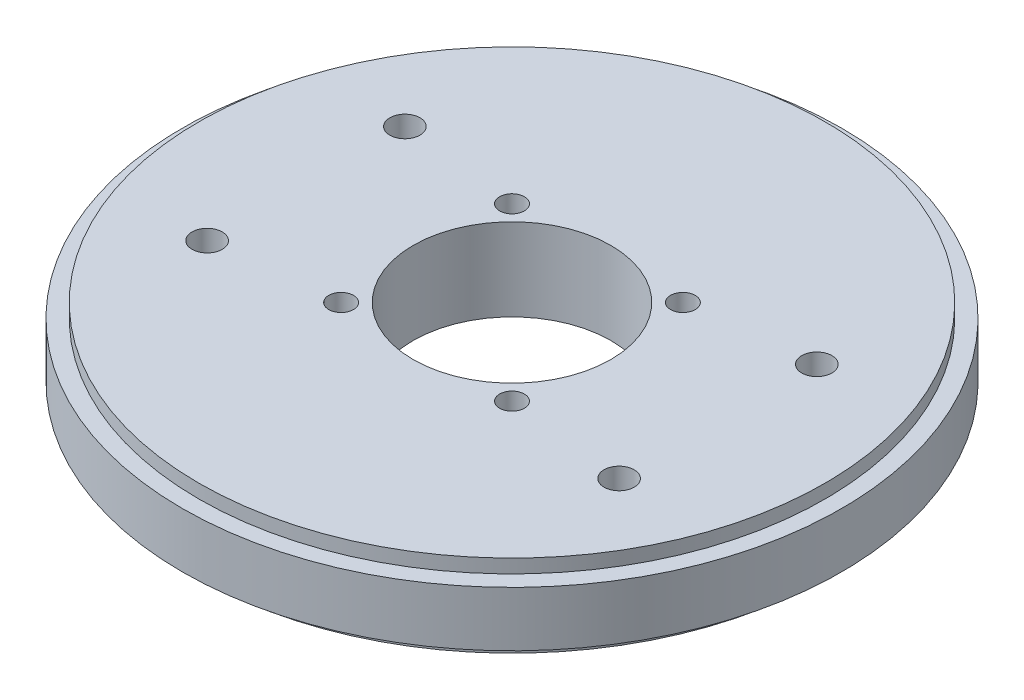
from build123d import *

# Parameters (mm, degrees)
SKETCH1_R                  = 57
EXTRUDE4_DEPTH             = 7.5
SKETCH_R                   = 60
SKETCH_R_2                 = 57
EXTRUDE5_DEPTH             = 5
EXTRUDE6_DEPTH             = 86.183625187
EXTRUDE6_DEPTH_BACK        = 86.183625187
SKETCH5_R                  = 18
F_4_5_4_5_DIAMETER_HOLE1_D = 4.5
CIRPATTERN1_COUNT          = 4
M5_CLEARANCE_HOLE1_D       = 5.5


with BuildPart() as part:
    # Sketch1 → Extrude4 (new, symmetric)
    with BuildSketch(Plane(origin=(0, 0, 0), x_dir=(1, 0, 0), z_dir=(0, 1, 0))):
        Circle(SKETCH1_R)
    extrude(amount=EXTRUDE4_DEPTH, both=True)

    # Sketch → Extrude5 (add, symmetric)
    with BuildSketch(Plane(origin=(0, 0, 0), x_dir=(1, 0, 0), z_dir=(0, 1, 0))):
        Circle(SKETCH_R)
        Circle(SKETCH_R_2, mode=Mode.SUBTRACT)
    extrude(amount=EXTRUDE5_DEPTH, both=True)

    # Sketch5 → Extrude6 (cut, two sides: drawn at the far end of the back side and taken through both)
    with BuildSketch(Plane(origin=(0, 0, 0), x_dir=(1, 0, 0), z_dir=(0, 1, 0)).offset(-EXTRUDE6_DEPTH_BACK)):
        Circle(SKETCH5_R)
    extrude(amount=EXTRUDE6_DEPTH + EXTRUDE6_DEPTH_BACK, mode=Mode.SUBTRACT)

    # Ø4.5 (4.5) Diameter Hole1 (through all)
    with Locations(Plane(origin=(0, -7.5, 0), x_dir=(-1, 0, 0), z_dir=(0, -1, 0))):
        with Locations((15.556349186, 15.556349186)):
            f_4_5_4_5_diameter_hole1 = Hole(F_4_5_4_5_DIAMETER_HOLE1_D / 2)

    # CirPattern1: Ø4.5 (4.5) Diameter Hole1 ×4 about axis
    cirpattern1_axis = Axis((0, -8.25, 0), (0, 1, 0))
    for i in range(1, CIRPATTERN1_COUNT):
        add(f_4_5_4_5_diameter_hole1.rotate(cirpattern1_axis, i * 360 / CIRPATTERN1_COUNT), mode=Mode.SUBTRACT)

    # M5 Clearance Hole1 (through all)
    with Locations(Plane(origin=(0, 7.5, 0), x_dir=(1, 0, 0), z_dir=(0, 1, 0))):
        with Locations((-37.5, 18), (-37.5, -18), (37.5, -18), (37.5, 18)):
            Hole(M5_CLEARANCE_HOLE1_D / 2)


solid = part.part
